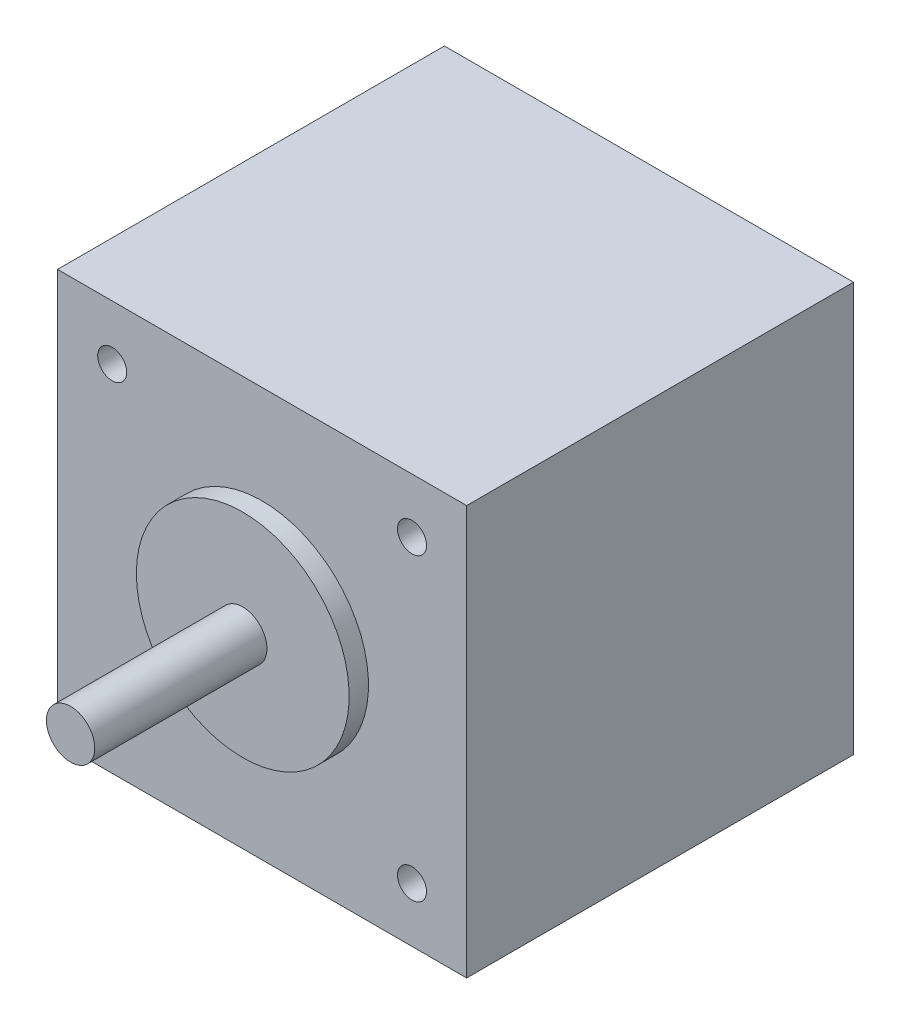
from build123d import *

# Parameters (mm, degrees)
SKETCH_1_W          = 42.3
SKETCH_1_H          = 42.3
EXTRUDE_1234_DEPTH  = 40
SKETCH_2_R          = 2.5
EXTRUDE_1289_DEPTH  = 59.8
SKETCH_3_R          = 11
EXTRUDE_1336_DEPTH  = 42
CUT_EXTRUDE_START   = 40
SKETCH_5_R          = 1.5
CUT_EXTRUDE_3_DEPTH = 4.5


with BuildPart() as part:
    # Эскиз1 → Extrude 1234 (new body)
    with BuildSketch(Plane.XY):
        Rectangle(SKETCH_1_W, SKETCH_1_H)
    extrude(amount=EXTRUDE_1234_DEPTH)

    # Эскиз2 → Extrude 1289 (add)
    with BuildSketch(Plane.XY):
        Circle(SKETCH_2_R)
    extrude(amount=EXTRUDE_1289_DEPTH)

    # Эскиз3 → Extrude 1336 (add)
    with BuildSketch(Plane.XY):
        Circle(SKETCH_3_R)
    extrude(amount=EXTRUDE_1336_DEPTH)

    # Эскиз5 → Крепеж_М3_ПРЕДВ (cut)
    with BuildSketch(Plane.XY.offset(CUT_EXTRUDE_START)):
        with Locations((-15.5, -15.5)):
            Circle(SKETCH_5_R)
        with Locations((-15.5, 15.5)):
            Circle(SKETCH_5_R)
        with Locations((15.5, -15.5)):
            Circle(SKETCH_5_R)
        with Locations((15.5, 15.5)):
            Circle(SKETCH_5_R)
    extrude(amount=-CUT_EXTRUDE_3_DEPTH, mode=Mode.SUBTRACT)


solid = part.part
